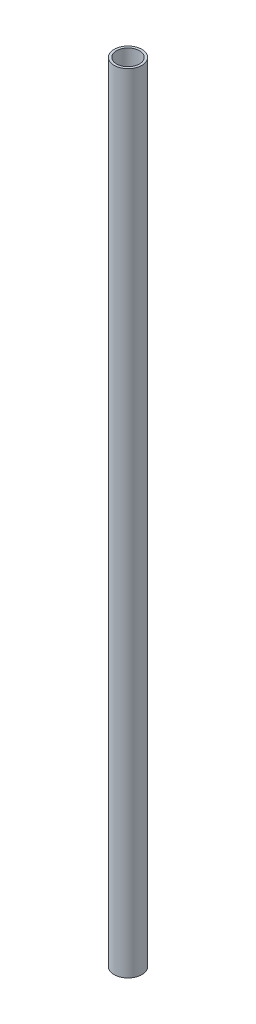
from build123d import *

# Parameters (mm, degrees)
SKETCH1_R           = 17.4625
SKETCH1_R_2         = 14.4145
BOSS_EXTRUDE1_DEPTH = 989.9


with BuildPart() as part:
    # Sketch1 → Boss-Extrude1 (new body)
    with BuildSketch(Plane(origin=(0, 0, 0), x_dir=(1, 0, 0), z_dir=(0, 1, 0))):
        Circle(SKETCH1_R)
        Circle(SKETCH1_R_2, mode=Mode.SUBTRACT)
    extrude(amount=BOSS_EXTRUDE1_DEPTH)


solid = part.part
